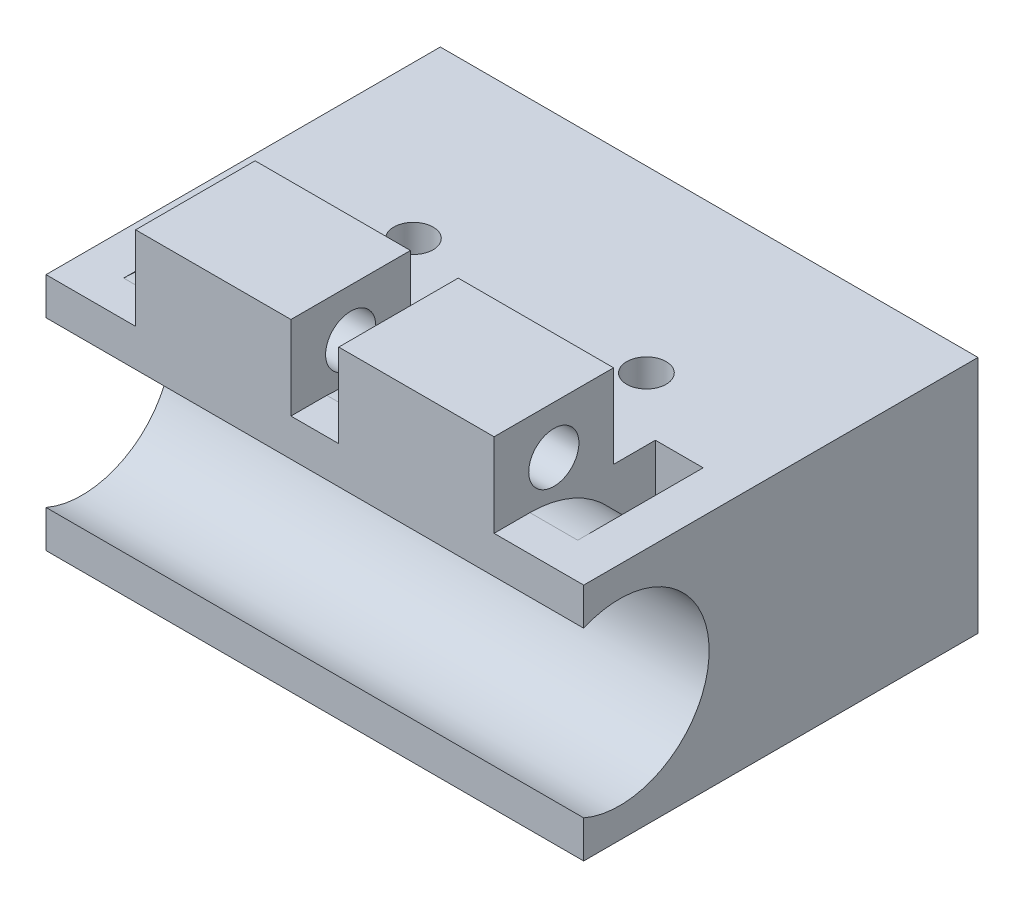
from build123d import *

# Parameters (mm, degrees)
SKETCH2_W             = 45
SKETCH2_H             = 20
BOSS_EXTRUDE1_DEPTH   = 33
SKETCH3_R             = 7.5
CUT_EXTRUDE1_DEPTH    = 45
SKETCH4_R             = 4
CUT_EXTRUDE2_DEPTH    = 10
SKETCH5_W             = 4
SKETCH5_H             = 1.5
CUT_EXTRUDE3_DEPTH    = 39
FILLET1_R             = 9
M4X0_7_TAPPED_HOLE1_D = 3.3
SKETCH8_W             = 13
SKETCH8_H             = 10
BOSS_EXTRUDE2_DEPTH   = 7
SKETCH14_R            = 2.1
CUT_EXTRUDE6_DEPTH    = 53.765992836
BODY_MOVE_COPY1_ANGLE = 180


with BuildPart() as part:
    # Sketch2 → Boss-Extrude1 (new body)
    with BuildSketch(Plane.XY):
        Rectangle(SKETCH2_W, SKETCH2_H)
    extrude(amount=BOSS_EXTRUDE1_DEPTH)

    # Sketch3 → Cut-Extrude1 (cut)
    with BuildSketch(Plane(origin=(22.5, 0, 0), x_dir=(0, 0, -1), z_dir=(1, 0, 0))):
        with Locations((-30, 0)):
            Circle(SKETCH3_R)
    extrude(amount=-CUT_EXTRUDE1_DEPTH, mode=Mode.SUBTRACT)

    # Sketch4 → Cut-Extrude2 (cut)
    with BuildSketch(Plane(origin=(0, 0, 0), x_dir=(-1, 0, 0), z_dir=(0, 0, -1))):
        with Locations((-15, 0)):
            Circle(SKETCH4_R)
        with Locations((15, 0)):
            Circle(SKETCH4_R)
    extrude(amount=-CUT_EXTRUDE2_DEPTH, mode=Mode.SUBTRACT)

    # Sketch5 → Cut-Extrude3 (cut)
    with BuildSketch(Plane.XZ.offset(10)):
        with Locations((-17, 20.25)):
            Rectangle(SKETCH5_W, SKETCH5_H)
        with Locations((0, 20.25)):
            Rectangle(SKETCH5_W, SKETCH5_H)
        with Locations((17, 20.25)):
            Rectangle(SKETCH5_W, SKETCH5_H)
    extrude(amount=-CUT_EXTRUDE3_DEPTH, mode=Mode.SUBTRACT)

    # Fillet1
    fillet1_edges = [part.edges().sort_by_distance(p)[0] for p in [
        (17, -10, 21),
        (0, -10, 21),
        (-17, -10, 21),
    ]]
    fillet(fillet1_edges, radius=FILLET1_R)

    # M4x0.7 Tapped Hole1 (through all)
    with Locations(Plane(origin=(0, -10, 0), x_dir=(-1, 0, 0), z_dir=(0, -1, 0))):
        with Locations((-9.75, -15), (9.75, -15)):
            Hole(M4X0_7_TAPPED_HOLE1_D / 2)

    # Sketch8 → Boss-Extrude2 (add)
    with BuildSketch(Plane.XZ.offset(10)):
        with Locations((-8.5, 28)):
            Rectangle(SKETCH8_W, SKETCH8_H)
        with Locations((8.5, 28)):
            Rectangle(SKETCH8_W, SKETCH8_H)
    extrude(amount=BOSS_EXTRUDE2_DEPTH)

    # Sketch14 → Cut-Extrude6 (cut, through all)
    with BuildSketch(Plane.ZY.offset(15)):
        with Locations((28, -13)):
            Circle(SKETCH14_R)
    extrude(amount=-CUT_EXTRUDE6_DEPTH, mode=Mode.SUBTRACT)


with BuildPart() as part_1:
    # Body-Move/Copy1: moved
    add(part.part.rotate(Axis((0, -3.5, 0), (0, 0, 1)), BODY_MOVE_COPY1_ANGLE))


solid = part_1.part
